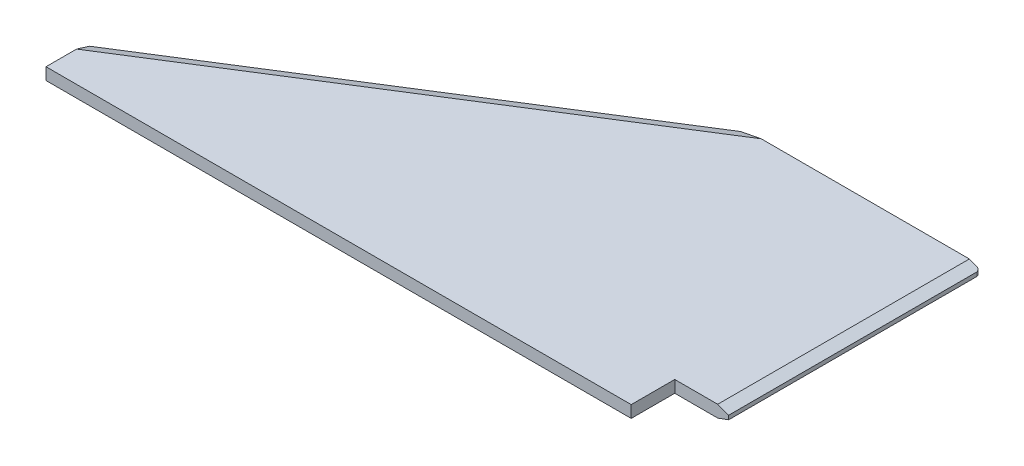
from build123d import *
from OCP.BRepFilletAPI import BRepFilletAPI_MakeChamfer

# Parameters (mm, degrees)
BOSS_EXTRUDE1_DEPTH = 3
CHAMFER1_SIZE       = 1
CHAMFER1_SIZE2      = 2.747477419
CHAMFER2_SIZE       = 1
CHAMFER2_SIZE2      = 2.747477419
FILLET1_R           = 1


with BuildPart() as part:
    # Sketch1 → Boss-Extrude1 (new body)
    with BuildSketch(Plane(origin=(0, 0, 0), x_dir=(1, 0, 0), z_dir=(0, 1, 0))):
        Polygon((0, 0), (0, 10.9), (100, 73.9), (160, 73.9), (160, 10.9), (146.5, 10.9), (146.5, 0), align=None)
    extrude(amount=BOSS_EXTRUDE1_DEPTH)

    # Chamfer1: one chamfer whose edges measure the first distance from different faces: ONE call of the kernel's chamfer builder (chamfer() names one face for all edges)
    chamfer1_edges_1 = [part.edges().sort_by_distance(p)[0] for p in [
        (160, 3, -42.4),
    ]]
    chamfer1_side_1 = [part.faces().sort_by_distance(p)[0] for p in [
        (160, 1.5, -42.4),
    ]]
    chamfer1_edges_2 = [part.edges().sort_by_distance(p)[0] for p in [
        (50, 3, -42.4),
    ]]
    chamfer1_side_2 = [part.faces().sort_by_distance(p)[0] for p in [
        (50, 1.5, -42.4),
    ]]
    chamfer1 = BRepFilletAPI_MakeChamfer(part.part.solid().wrapped)
    for e in chamfer1_edges_1:
        chamfer1.Add(CHAMFER1_SIZE, CHAMFER1_SIZE2, e.wrapped, chamfer1_side_1[0].wrapped)  # the first distance lies on this face
    for e in chamfer1_edges_2:
        chamfer1.Add(CHAMFER1_SIZE, CHAMFER1_SIZE2, e.wrapped, chamfer1_side_2[0].wrapped)  # the first distance lies on this face
    add(Compound.cast(chamfer1.Shape()), mode=Mode.REPLACE)

    # Chamfer2: one chamfer whose edges measure the first distance from different faces: ONE call of the kernel's chamfer builder (chamfer() names one face for all edges)
    chamfer2_edges_1 = [part.edges().sort_by_distance(p)[0] for p in [
        (50, 0, -42.4),
    ]]
    chamfer2_side_1 = [part.faces().sort_by_distance(p)[0] for p in [
        (50, 1, -42.4),
    ]]
    chamfer2_edges_2 = [part.edges().sort_by_distance(p)[0] for p in [
        (160, 0, -42.4),
    ]]
    chamfer2_side_2 = [part.faces().sort_by_distance(p)[0] for p in [
        (160, 1, -42.4),
    ]]
    chamfer2 = BRepFilletAPI_MakeChamfer(part.part.solid().wrapped)
    for e in chamfer2_edges_1:
        chamfer2.Add(CHAMFER2_SIZE, CHAMFER2_SIZE2, e.wrapped, chamfer2_side_1[0].wrapped)  # the first distance lies on this face
    for e in chamfer2_edges_2:
        chamfer2.Add(CHAMFER2_SIZE, CHAMFER2_SIZE2, e.wrapped, chamfer2_side_2[0].wrapped)  # the first distance lies on this face
    add(Compound.cast(chamfer2.Shape()), mode=Mode.REPLACE)

    # Fillet1
    fillet1_edges = [part.edges().sort_by_distance(p)[0] for p in [
        (160, 1.5, -73.9),
    ]]
    fillet(fillet1_edges, radius=FILLET1_R)


solid = part.part
